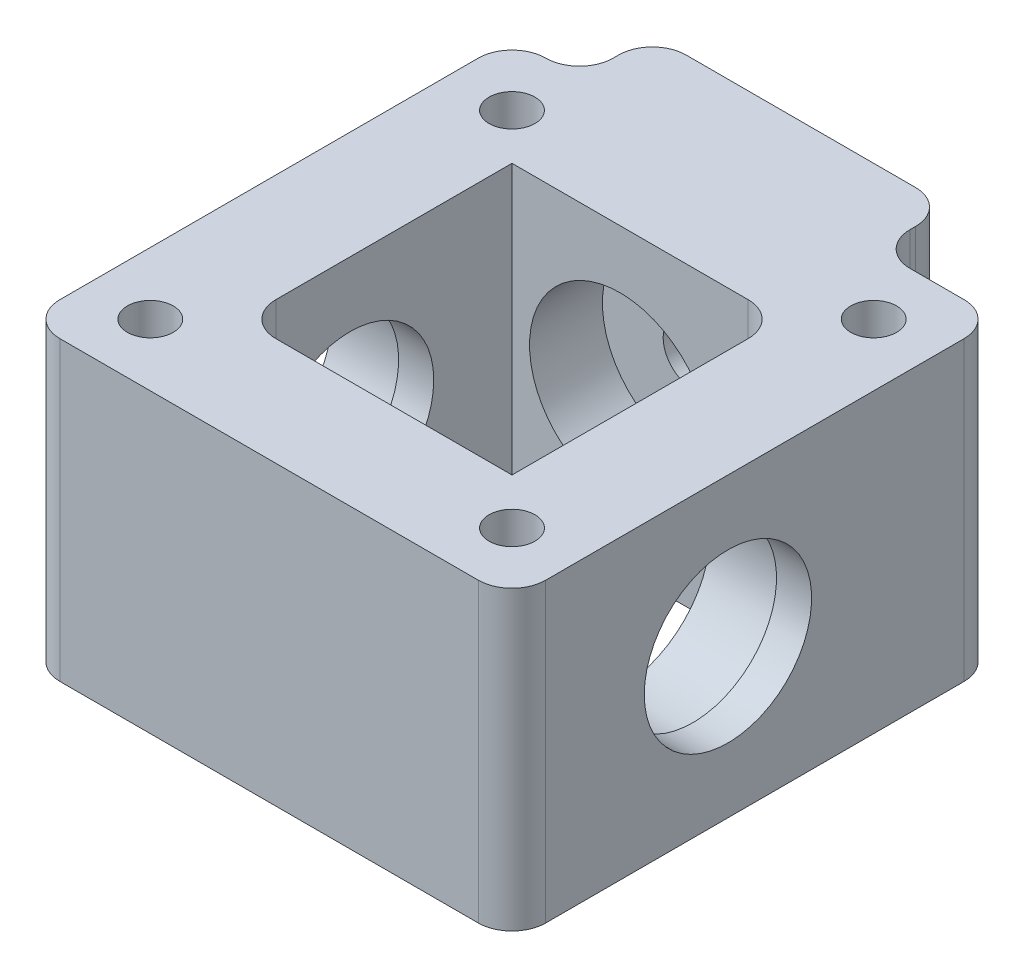
from build123d import *

# Parameters (mm, degrees)
SKETCH3_W               = 36
SKETCH3_H               = 36
SKETCH3_W_2             = 20
SKETCH3_H_2             = 20
BOSS_EXTRUDE1_DEPTH     = 22
CUT_EXTRUDE1_REACH      = 57.462
SKETCH4_R               = 2.2
CUT_EXTRUDE2_DEPTH      = 56.461698495
CUT_EXTRUDE2_DEPTH_BACK = 56.461698495
SKETCH5_R               = 6.2
SKETCH6_W               = 22
SKETCH6_H               = 22
SKETCH6_R               = 6.7
BOSS_EXTRUDE2_DEPTH     = 5.4
SKETCH7_R               = 6.7
CUT_EXTRUDE3_DEPTH      = 5.4
SKETCH8_R               = 6.7
CUT_EXTRUDE4_DEPTH      = 5.4
SKETCH9_R               = 6.7
CUT_EXTRUDE5_DEPTH      = 5.4
FILLET2_R               = 2.5
FILLET3_R               = 2.5
FILLET4_R               = 2.5
SKETCH10_R              = 1.7
CUT_EXTRUDE6_DEPTH      = 56.461698535


with BuildPart() as part:
    # Sketch3 → Boss-Extrude1 (new body)
    with BuildSketch(Plane(origin=(0, 0, 0), x_dir=(1, 0, 0), z_dir=(0, 1, 0))):
        with Locations((18, -18)):
            Rectangle(SKETCH3_W, SKETCH3_H)
        with Locations((18, -18)):
            Rectangle(SKETCH3_W_2, SKETCH3_H_2, mode=Mode.SUBTRACT)
    extrude(amount=BOSS_EXTRUDE1_DEPTH)

    # Sketch4 → Cut-Extrude1 (cut, up to next)
    with BuildSketch(Plane(origin=(0, 0, 0), x_dir=(-1, 0, 0), z_dir=(0, 0, -1)), mode=Mode.PRIVATE) as cut_extrude1_sk1:
        with Locations((-16, 11)):
            Circle(SKETCH4_R)
    cut_extrude1_tool1 = extrude(cut_extrude1_sk1.sketch, amount=-CUT_EXTRUDE1_REACH, mode=Mode.PRIVATE) & part.part
    add(cut_extrude1_tool1.solids().sort_by_distance((16, 11, 0))[0], mode=Mode.SUBTRACT)

    # Sketch5 → Cut-Extrude2 (cut, two sides: drawn at the far end of the back side and taken through both)
    with BuildSketch(Plane(origin=(36, 0, 0), x_dir=(0, 0, -1), z_dir=(1, 0, 0)).offset(-CUT_EXTRUDE2_DEPTH_BACK)):
        with Locations(Location((-20, 11, 0), (0, 0, 180))):
            Circle(SKETCH5_R)
    extrude(amount=CUT_EXTRUDE2_DEPTH + CUT_EXTRUDE2_DEPTH_BACK, mode=Mode.SUBTRACT)

    # Sketch6 → Boss-Extrude2 (add)
    with BuildSketch(Plane(origin=(0, 0, 0), x_dir=(-1, 0, 0), z_dir=(0, 0, -1))):
        with Locations((-16, 11)):
            Rectangle(SKETCH6_W, SKETCH6_H)
        with Locations(Location((-16, 11, 0), (0, 0, 180))):
            Circle(SKETCH6_R, mode=Mode.SUBTRACT)
    extrude(amount=BOSS_EXTRUDE2_DEPTH)

    # Sketch7 → Cut-Extrude3 (cut)
    with BuildSketch(Plane.XY.offset(8)):
        with Locations((16, 11)):
            Circle(SKETCH7_R)
    extrude(amount=-CUT_EXTRUDE3_DEPTH, mode=Mode.SUBTRACT)

    # Sketch8 → Cut-Extrude4 (cut)
    with BuildSketch(Plane.ZY.offset(-28)):
        with Locations((20, 11)):
            Circle(SKETCH8_R)
    extrude(amount=-CUT_EXTRUDE4_DEPTH, mode=Mode.SUBTRACT)

    # Sketch9 → Cut-Extrude5 (cut)
    with BuildSketch(Plane.ZY):
        with Locations((20, 11)):
            Circle(SKETCH9_R)
    extrude(amount=-CUT_EXTRUDE5_DEPTH, mode=Mode.SUBTRACT)

    # Fillet2
    fillet2_edges = [part.edges().sort_by_distance(p)[0] for p in [
        (5, 11, -5.4),
        (27, 11, -5.4),
        (5, 11, 0),
        (27, 11, 0),
    ]]
    fillet(fillet2_edges, radius=FILLET2_R)

    # Fillet3
    fillet3_edges = [part.edges().sort_by_distance(p)[0] for p in [
        (8, 11, 28),
        (28, 11, 8),
    ]]
    fillet(fillet3_edges, radius=FILLET3_R)

    # Fillet4
    fillet4_edges = [part.edges().sort_by_distance(p)[0] for p in [
        (0, 11, 0),
        (36, 11, 0),
        (36, 11, 36),
        (0, 11, 36),
    ]]
    fillet(fillet4_edges, radius=FILLET4_R - 0.0001)  # a hair under: the kernel refuses the full size

    # Sketch10 → Cut-Extrude6 (cut, through all)
    with BuildSketch(Plane(origin=(0, 0, 0), x_dir=(-1, 0, 0), z_dir=(0, -1, 0))):
        with Locations(Location((-31.4, -4.6, 0), (0, 0, 90))):
            Circle(SKETCH10_R)
        with Locations(Location((-4.6, -4.6, 0), (0, 0, 90))):
            Circle(SKETCH10_R)
        with Locations(Location((-4.6, -31.4, 0), (0, 0, 90))):
            Circle(SKETCH10_R)
        with Locations(Location((-31.4, -31.4, 0), (0, 0, 90))):
            Circle(SKETCH10_R)
    extrude(amount=-CUT_EXTRUDE6_DEPTH, mode=Mode.SUBTRACT)


solid = part.part
